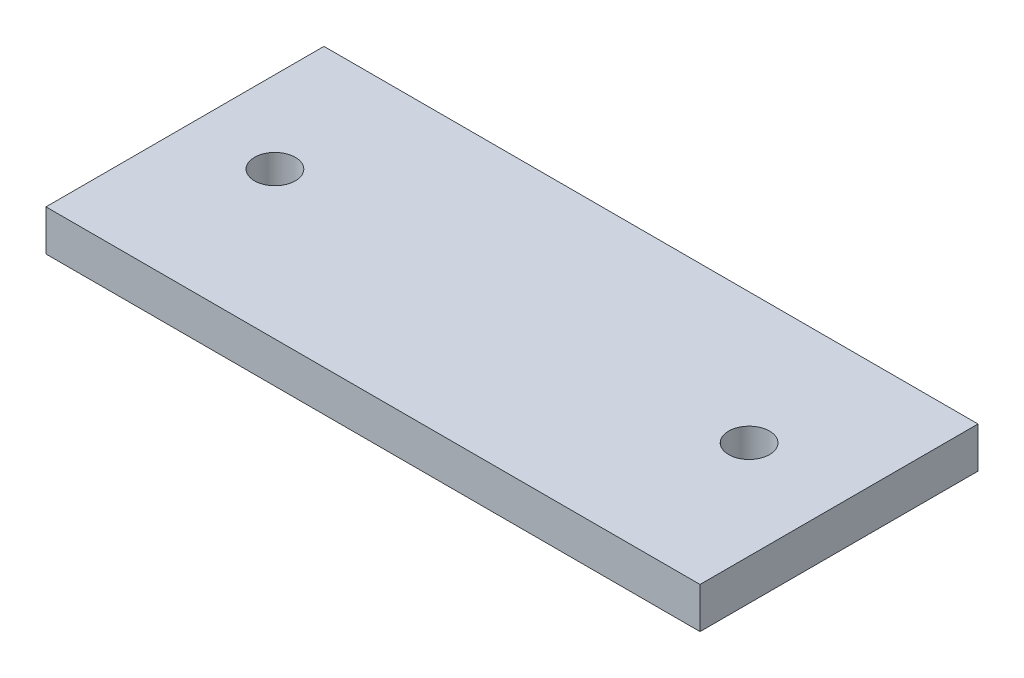
from build123d import *

# Parameters (mm, degrees)
SKETCH1_W           = 50.8
SKETCH1_H           = 21.59
SKETCH1_R           = 1.5875
BOSS_EXTRUDE1_DEPTH = 3.175


with BuildPart() as part:
    # Sketch1 → Boss-Extrude1 (new body)
    with BuildSketch(Plane(origin=(0, 0, 0), x_dir=(1, 0, 0), z_dir=(0, 1, 0))):
        Rectangle(SKETCH1_W, SKETCH1_H)
        with Locations((-19.05, 0.635)):
            Circle(SKETCH1_R, mode=Mode.SUBTRACT)
        with Locations((17.78, 0.635)):
            Circle(SKETCH1_R, mode=Mode.SUBTRACT)
    extrude(amount=BOSS_EXTRUDE1_DEPTH)


solid = part.part
